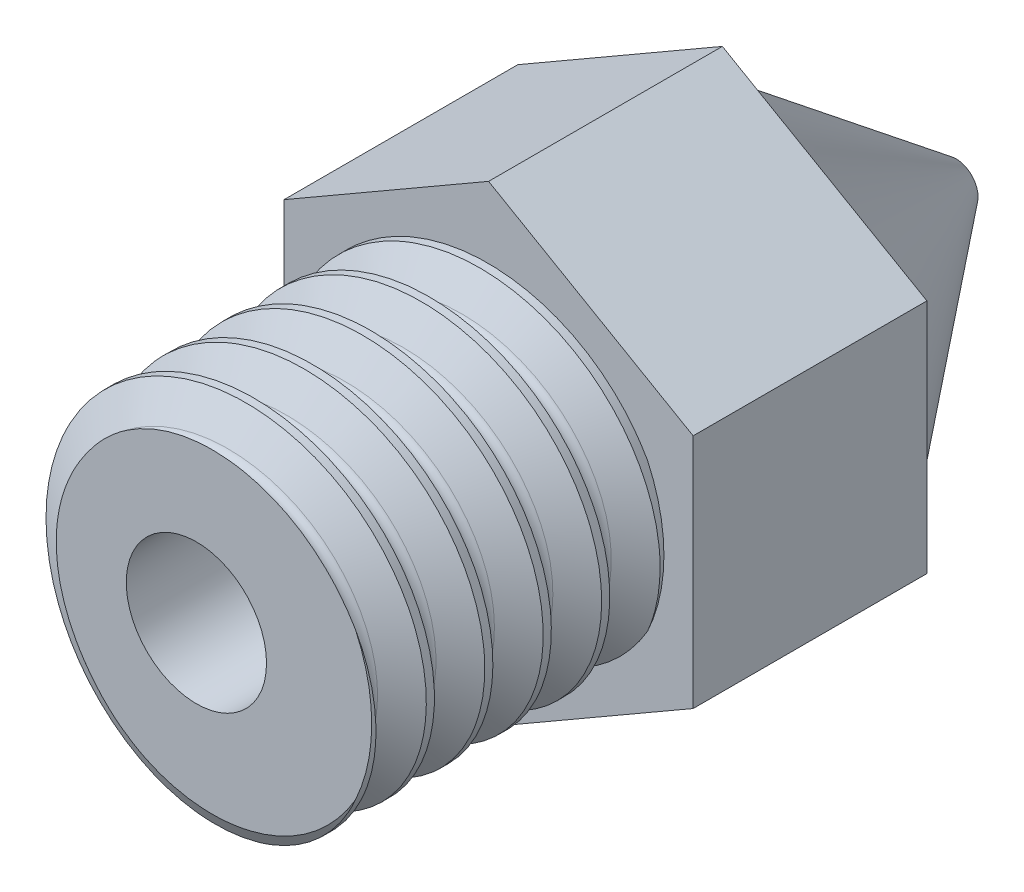
from build123d import *

# Parameters (mm, degrees)
SKETCH1_R                      = 3
BOSS_EXTRUDE1_DEPTH            = 5
CUT_SWEEP2_PITCH               = 1
BOSS_EXTRUDE2_DEPTH            = 4
SKETCH5_R                      = 3.5
BOSS_EXTRUDE3_DEPTH            = 4
BOSS_EXTRUDE3_TAPER            = 38
F_2_4_2_4_DIAMETER_HOLE1_D     = 2.4
F_2_4_2_4_DIAMETER_HOLE1_DEPTH = 10.79
F_2_4_2_4_DIAMETER_HOLE1_TIP   = 0.721032743
SKETCH10_R                     = 0.1
CUT_EXTRUDE1_DEPTH             = 5


with BuildPart() as part:
    # Sketch1 → Boss-Extrude1 (new body)
    with BuildSketch(Plane.XY):
        Circle(SKETCH1_R)
    extrude(amount=BOSS_EXTRUDE1_DEPTH)

    # Cut-Sweep2: arcs per turn and ends read off the stored shape
    # Cut-Sweep2: the profile of Sketch3 screwed along a right-hand helix through 7.25 turns, 8 arcs to a turn; built about Z, then put on its axis
    cut_sweep2_z = Axis((0, 0, 0), (0, 0, 1))
    cut_sweep2_corners = [(2.470120819, 0, -0.875292342), (3.033543682, 0, -0.55), (3.033543682, 0, -1.45), (2.470120819, 0, -1.124707658), (2.398120819, 0, -1)]
    with BuildLine(mode=Mode.PRIVATE) as cut_sweep2_profile:
        Line(cut_sweep2_corners[0], cut_sweep2_corners[1])
        Line(cut_sweep2_corners[1], cut_sweep2_corners[2])
        Line(cut_sweep2_corners[2], cut_sweep2_corners[3])
        ThreePointArc((2.470120819, 0, -1.124707658), (2.41741316, 0, -1.072), (2.398120819, 0, -1))
        ThreePointArc((2.398120819, 0, -1), (2.41741316, 0, -0.928), (2.470120819, 0, -0.875292342))
    cut_sweep2_cap = Face(cut_sweep2_profile.wire())
    cut_sweep2_arcs = [((2.470120819, 0, -1.124707658), (2.398120819, 0, -1.083138439), (2.398120819, 0, -1), (1, 0.8660254037844366, 1)), ((2.398120819, 0, -1), (2.398120819, 0, -0.916861561), (2.470120819, 0, -0.875292342), (1, 0.8660254037844366, 1))]  # start, shoulder, end, weights
    cut_sweep2_turn_angles = [0, 22.5, 45, 67.5, 90, 112.5, 135, 157.5, 180, 202.5, 225, 247.5, 270, 292.5, 315, 337.5, 360]
    cut_sweep2_turn_weights = [1, 0.9238795325112867, 1, 0.9238795325112867, 1, 0.9238795325112867, 1, 0.9238795325112867, 1, 0.9238795325112867, 1, 0.9238795325112867, 1, 0.9238795325112867, 1, 0.9238795325112867, 1]
    cut_sweep2_turn_rails = [Edge.make_bspline([Vector(p[0], p[1], 0).rotate(cut_sweep2_z, cut_sweep2_turn_angles[k]) / cut_sweep2_turn_weights[k] + Vector(0, 0, p[2] + CUT_SWEEP2_PITCH * cut_sweep2_turn_angles[k] / 360) for k in range(17)], [0, 0, 0, 1, 1, 2, 2, 3, 3, 4, 4, 5, 5, 6, 6, 7, 7, 8, 8, 8], 2, cut_sweep2_turn_weights) for p in cut_sweep2_corners]
    cut_sweep2_turn_sides = [*[Face.make_surface_from_curves(cut_sweep2_turn_rails[p[0]], cut_sweep2_turn_rails[p[1]]) for p in [(0, 1), (1, 2), (2, 3)]], *[Face.make_bezier_surface([[Vector(p[j][0], p[j][1], 0).rotate(cut_sweep2_z, cut_sweep2_turn_angles[2 * i + k]) / cut_sweep2_turn_weights[2 * i + k] + Vector(0, 0, p[j][2] + CUT_SWEEP2_PITCH * cut_sweep2_turn_angles[2 * i + k] / 360) for k in range(3)] for j in range(3)], [[p[3][j] * cut_sweep2_turn_weights[2 * i + k] for k in range(3)] for j in range(3)]) for p in cut_sweep2_arcs for i in range(8)]]
    cut_sweep2_last_angles = [2520, 2542.5, 2565, 2587.5, 2610]
    cut_sweep2_last_weights = [1, 0.9238795325112867, 1, 0.9238795325112867, 1]
    cut_sweep2_last_rails = [Edge.make_bspline([Vector(p[0], p[1], 0).rotate(cut_sweep2_z, cut_sweep2_last_angles[k]) / cut_sweep2_last_weights[k] + Vector(0, 0, p[2] + CUT_SWEEP2_PITCH * cut_sweep2_last_angles[k] / 360) for k in range(5)], [0, 0, 0, 1, 1, 2, 2, 2], 2, cut_sweep2_last_weights) for p in cut_sweep2_corners]
    cut_sweep2_last_sides = [*[Face.make_surface_from_curves(cut_sweep2_last_rails[p[0]], cut_sweep2_last_rails[p[1]]) for p in [(0, 1), (1, 2), (2, 3)]], *[Face.make_bezier_surface([[Vector(p[j][0], p[j][1], 0).rotate(cut_sweep2_z, cut_sweep2_last_angles[2 * i + k]) / cut_sweep2_last_weights[2 * i + k] + Vector(0, 0, p[j][2] + CUT_SWEEP2_PITCH * cut_sweep2_last_angles[2 * i + k] / 360) for k in range(3)] for j in range(3)], [[p[3][j] * cut_sweep2_last_weights[2 * i + k] for k in range(3)] for j in range(3)]) for p in cut_sweep2_arcs for i in range(2)]]
    cut_sweep2 = Plane(origin=(0, 0, 5), x_dir=(-1, 0, 0), z_dir=(0, 0, -1)) * Solid(Shell([*[p.moved(Location((0, 0, CUT_SWEEP2_PITCH * i))) for i in range(7) for p in cut_sweep2_turn_sides], *cut_sweep2_last_sides, cut_sweep2_cap, cut_sweep2_cap.rotate(cut_sweep2_z, 2610).moved(Location((0, 0, CUT_SWEEP2_PITCH * 2610 / 360)))]))
    add(cut_sweep2, mode=Mode.SUBTRACT)

    # Sketch4 → Boss-Extrude2 (add)
    with BuildSketch(Plane(origin=(0, 0, 0), x_dir=(-1, 0, 0), z_dir=(0, 0, -1))):
        Polygon((0, 4.041451884), (-3.5, 2.020725942), (-3.5, -2.020725942), (0, -4.041451884), (3.5, -2.020725942), (3.5, 2.020725942), align=None)
    extrude(amount=BOSS_EXTRUDE2_DEPTH)

    # Sketch5 → Boss-Extrude3 (add)
    with BuildSketch(Plane(origin=(0, 0, -4), x_dir=(-1, 0, 0), z_dir=(0, 0, -1))):
        Circle(SKETCH5_R)
    extrude(amount=BOSS_EXTRUDE3_DEPTH, taper=BOSS_EXTRUDE3_TAPER)

    # Ø2.4 (2.4) Diameter Hole1
    with Locations(Plane.XY.offset(5)):
        with Locations((0, 0)):
            Hole(F_2_4_2_4_DIAMETER_HOLE1_D / 2, depth=F_2_4_2_4_DIAMETER_HOLE1_DEPTH)
            with Locations((0, 0, -(F_2_4_2_4_DIAMETER_HOLE1_DEPTH + F_2_4_2_4_DIAMETER_HOLE1_TIP / 2))):  # 118° drill point
                Cone(0, F_2_4_2_4_DIAMETER_HOLE1_D / 2, F_2_4_2_4_DIAMETER_HOLE1_TIP, mode=Mode.SUBTRACT)

    # Sketch10 → Cut-Extrude1 (cut)
    with BuildSketch(Plane(origin=(0, 0, -8), x_dir=(-1, 0, 0), z_dir=(0, 0, -1))):
        Circle(SKETCH10_R)
    extrude(amount=-CUT_EXTRUDE1_DEPTH, mode=Mode.SUBTRACT)


solid = part.part
